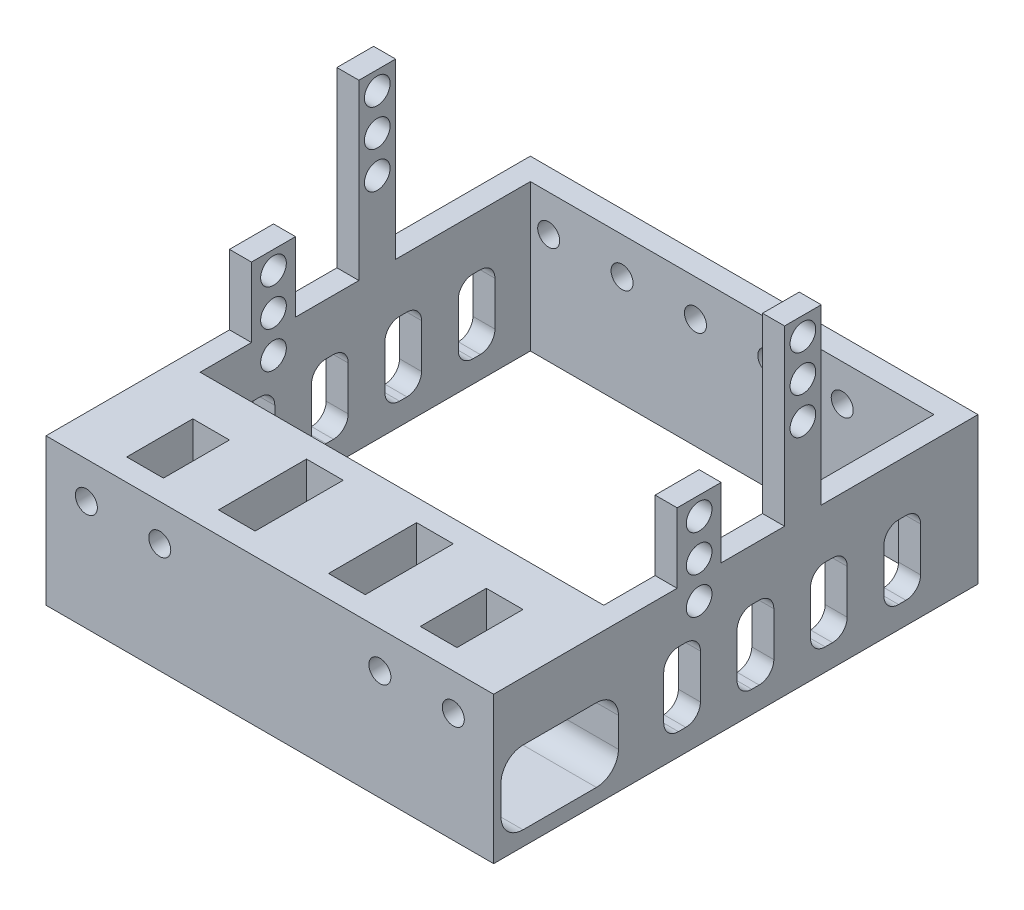
from build123d import *
from build123d.topology import SkipClean

# Parameters (mm, degrees)
SKETCH1_W           = 55
SKETCH1_H           = 10
SKETCH1_R           = 1.5
BOSS_EXTRUDE1_DEPTH = 15
BOSS_EXTRUDE2_START = 3
SKETCH2_R           = 1.5
BOSS_EXTRUDE2_DEPTH = 3
SKETCH3_W           = 55
SKETCH3_H           = 18
BOSS_EXTRUDE3_DEPTH = 10
BOSS_EXTRUDE5_DEPTH = 3
BOSS_EXTRUDE6_DEPTH = 3
CUT_EXTRUDE2_DEPTH  = 84.492514635
SKETCH10_W          = 3
SKETCH10_H          = 20
BOSS_EXTRUDE7_DEPTH = 45
SKETCH11_R          = 1.75
CUT_EXTRUDE3_DEPTH  = 96.131487952
SKETCH12_W          = 5
SKETCH12_H          = 23.64
SKETCH12_R          = 1.75
SKETCH12_W_2        = 6
SKETCH12_H_2        = 9.5
BOSS_EXTRUDE8_DEPTH = 3
BOSS_EXTRUDE9_START = 3
SKETCH13_W          = 61
SKETCH13_H          = 20
SKETCH13_R          = 1.5
BOSS_EXTRUDE9_DEPTH = 3
SKETCH14_W          = 5
SKETCH14_H          = 12
SKETCH14_H_2        = 9
CUT_EXTRUDE4_DEPTH  = 10
CUT_EXTRUDE5_DEPTH  = 97.679884154
SKETCH16_W          = 3
SKETCH16_H          = 45
CUT_EXTRUDE6_DEPTH  = 97.679884154


with BuildPart() as part:
    # Sketch1 → Boss-Extrude1 (new body)
    with BuildSketch(Plane.XY):
        with Locations((-27.5, 5)):
            Rectangle(SKETCH1_W, SKETCH1_H)
        with Locations((-2.5, 5)):
            Circle(SKETCH1_R, mode=Mode.SUBTRACT)
        with Locations((-12.5, 5)):
            Circle(SKETCH1_R, mode=Mode.SUBTRACT)
        with Locations((-42.5, 5)):
            Circle(SKETCH1_R, mode=Mode.SUBTRACT)
        with Locations((-52.5, 5)):
            Circle(SKETCH1_R, mode=Mode.SUBTRACT)
    extrude(amount=BOSS_EXTRUDE1_DEPTH)

    # Sketch2 → Boss-Extrude2 (add)
    with SkipClean():  # the faces are left unmerged after this step: merging them gives an invalid solid
        with BuildSketch(Plane(origin=(0, 0, 0), x_dir=(-1, 0, 0), z_dir=(0, 0, -1)).offset(BOSS_EXTRUDE2_START)):
            with BuildLine():
                Line((0, 0), (55, 0))
                Line((55, 0), (55, 55))
                Line((55, 55), (40, 55))
                Line((40, 55), (40, 24.74951996))
                ThreePointArc((40, 24.74951996), (41, 22.300030217), (40, 19.850540474))
                Line((40, 19.850540474), (40, 10))
                Line((40, 10), (15, 10))
                Line((15, 10), (15, 19.850540474))
                ThreePointArc((15, 19.850540474), (14, 22.300030217), (15, 24.74951996))
                Line((15, 24.74951996), (15, 55))
                Line((15, 55), (0, 55))
                Line((0, 55), (0, 0))
            make_face()
            with Locations((2.5, 5)):
                Circle(SKETCH2_R, mode=Mode.SUBTRACT)
            with Locations((12.5, 5)):
                Circle(SKETCH2_R, mode=Mode.SUBTRACT)
            with Locations((12.5, 50)):
                Circle(SKETCH2_R, mode=Mode.SUBTRACT)
            with Locations((2.5, 50)):
                Circle(SKETCH2_R, mode=Mode.SUBTRACT)
            with Locations((52.5, 5)):
                Circle(SKETCH2_R, mode=Mode.SUBTRACT)
            with Locations((42.5, 5)):
                Circle(SKETCH2_R, mode=Mode.SUBTRACT)
            with Locations((52.5, 50)):
                Circle(SKETCH2_R, mode=Mode.SUBTRACT)
            with Locations((42.5, 50)):
                Circle(SKETCH2_R, mode=Mode.SUBTRACT)
        extrude(amount=-BOSS_EXTRUDE2_DEPTH)

    # Sketch3 → Boss-Extrude3 (add)
    with SkipClean():  # the faces are left unmerged after this step: merging them gives an invalid solid
        with BuildSketch(Plane.XZ):
            with Locations((-27.5, 6)):
                Rectangle(SKETCH3_W, SKETCH3_H)
        extrude(amount=BOSS_EXTRUDE3_DEPTH)

    # Sketch6 → Boss-Extrude5 (add)
    with SkipClean():  # the faces are left unmerged after this step: merging them gives an invalid solid
        with BuildSketch(Plane(origin=(0, 0, 0), x_dir=(0, 0, -1), z_dir=(1, 0, 0))):
            Polygon((-15, 10), (-15, -10), (3, -10), (3, 55), (0, 55), (0, 10), align=None)
        extrude(amount=BOSS_EXTRUDE5_DEPTH)

    # Sketch8 → Boss-Extrude6 (add)
    with SkipClean():  # the faces are left unmerged after this step: merging them gives an invalid solid
        with BuildSketch(Plane.ZY.offset(55)):
            Polygon((15, 10), (0, 10), (0, 55), (-3, 55), (-3, -10), (15, -10), align=None)
        extrude(amount=BOSS_EXTRUDE6_DEPTH)

    # Sketch9 → Cut-Extrude2 (cut, through all)
    with SkipClean():  # the faces are left unmerged after this step: merging them gives an invalid solid
        with BuildSketch(Plane.ZY.offset(58)):
            with BuildLine():
                Line((1, -8), (11, -8))
                ThreePointArc((11, -8), (13.121320344, -7.121320344), (14, -5))
                Line((14, -5), (14, -1))
                ThreePointArc((14, -1), (13.121320344, 1.121320344), (11, 2))
                Line((11, 2), (1, 2))
                ThreePointArc((1, 2), (-1.121320344, 1.121320344), (-2, -1))
                Line((-2, -1), (-2, -5))
                ThreePointArc((-2, -5), (-1.121320344, -7.121320344), (1, -8))
            make_face()
        extrude(amount=-CUT_EXTRUDE2_DEPTH, mode=Mode.SUBTRACT)

    # Sketch10 → Boss-Extrude7 (add)
    with SkipClean():  # the faces are left unmerged after this step: merging them gives an invalid solid
        with BuildSketch(Plane(origin=(0, 0, -3), x_dir=(-1, 0, 0), z_dir=(0, 0, -1))):
            with Locations((56.5, 0)):
                Rectangle(SKETCH10_W, SKETCH10_H)
            with Locations((-1.5, 0)):
                Rectangle(SKETCH10_W, SKETCH10_H)
        extrude(amount=BOSS_EXTRUDE7_DEPTH)

    # Sketch11 → Cut-Extrude3 (cut, through all)
    with SkipClean():  # the faces are left unmerged after this step: merging them gives an invalid solid
        with BuildSketch(Plane.ZY.offset(58)):
            with Locations((-13, 7)):
                Circle(SKETCH11_R)
        extrude(amount=-CUT_EXTRUDE3_DEPTH, mode=Mode.SUBTRACT)

    # Sketch12 → Boss-Extrude8 (add)
    # profile 1 of 2: a face of its own
    with SkipClean():  # the faces are left unmerged after this step: merging them gives an invalid solid
        with BuildSketch(Plane.ZY.offset(58)):
            with Locations((-27.14, 21.82)):
                Rectangle(SKETCH12_W, SKETCH12_H)
            with Locations((-27.14, 31.14)):
                Circle(SKETCH12_R, mode=Mode.SUBTRACT)
            with Locations((-27.14, 26.14)):
                Circle(SKETCH12_R, mode=Mode.SUBTRACT)
            with Locations((-27.14, 21.14)):
                Circle(SKETCH12_R, mode=Mode.SUBTRACT)
        # profile 2 of 2: a face of its own
        with BuildSketch(Plane.ZY.offset(58)):
            with Locations((-13, 14.75)):
                Rectangle(SKETCH12_W_2, SKETCH12_H_2)
            with Locations((-13, 17)):
                Circle(SKETCH12_R, mode=Mode.SUBTRACT)
            with Locations((-13, 12)):
                Circle(SKETCH12_R, mode=Mode.SUBTRACT)
        boss_extrude8 = extrude(amount=-BOSS_EXTRUDE8_DEPTH)

    # Mirror1: Boss-Extrude8 across plane
    with SkipClean():  # the faces are left unmerged after this step: merging them gives an invalid solid
        add(boss_extrude8.mirror(Plane.ZY.offset(27.5)))

    # Sketch13 → Boss-Extrude9 (add)
    with SkipClean():  # the faces are left unmerged after this step: merging them gives an invalid solid
        with BuildSketch(Plane(origin=(0, 0, -48), x_dir=(-1, 0, 0), z_dir=(0, 0, -1)).offset(BOSS_EXTRUDE9_START)):
            with Locations((27.5, 0)):
                Rectangle(SKETCH13_W, SKETCH13_H)
            with Locations((22.5, 5)):
                Circle(SKETCH13_R, mode=Mode.SUBTRACT)
            with Locations((12.5, 5)):
                Circle(SKETCH13_R, mode=Mode.SUBTRACT)
            with Locations((2.5, 5)):
                Circle(SKETCH13_R, mode=Mode.SUBTRACT)
            with Locations((52.5, 5)):
                Circle(SKETCH13_R, mode=Mode.SUBTRACT)
            with Locations((42.5, 5)):
                Circle(SKETCH13_R, mode=Mode.SUBTRACT)
            with Locations((32.5, 5)):
                Circle(SKETCH13_R, mode=Mode.SUBTRACT)
        extrude(amount=-BOSS_EXTRUDE9_DEPTH)

    # Sketch14 → Cut-Extrude4 (cut)
    with SkipClean():  # the faces are left unmerged after this step: merging them gives an invalid solid
        with BuildSketch(Plane(origin=(0, 10, 0), x_dir=(1, 0, 0), z_dir=(0, 1, 0))):
            with Locations((-35, -6)):
                Rectangle(SKETCH14_W, SKETCH14_H)
            with Locations((-47.5, -7.5)):
                Rectangle(SKETCH14_W, SKETCH14_H_2)
            with Locations((-20, -6)):
                Rectangle(SKETCH14_W, SKETCH14_H)
            with Locations((-7.5, -7.5)):
                Rectangle(SKETCH14_W, SKETCH14_H_2)
        extrude(amount=-CUT_EXTRUDE4_DEPTH, mode=Mode.SUBTRACT)

    # Sketch15 → Cut-Extrude5 (cut, through all)
    with SkipClean():  # the faces are left unmerged after this step: merging them gives an invalid solid
        with BuildSketch(Plane.ZY.offset(58)):
            with BuildLine():
                Line((-10.176090021, -7), (-11.176090021, -7))
                ThreePointArc((-11.176090021, -7), (-12.590303583, -6.414213562), (-13.176090021, -5))
                Line((-13.176090021, -5), (-13.176090021, 1))
                ThreePointArc((-13.176090021, 1), (-12.590303583, 2.414213562), (-11.176090021, 3))
                Line((-11.176090021, 3), (-10.176090021, 3))
                ThreePointArc((-10.176090021, 3), (-8.761876459, 2.414213562), (-8.176090021, 1))
                Line((-8.176090021, 1), (-8.176090021, -5))
                ThreePointArc((-8.176090021, -5), (-8.761876459, -6.414213562), (-10.176090021, -7))
            make_face()
            with BuildLine():
                Line((-18.176090021, -5), (-18.176090021, 1))
                ThreePointArc((-18.176090021, 1), (-18.761876459, 2.414213562), (-20.176090021, 3))
                Line((-20.176090021, 3), (-21.176090021, 3))
                ThreePointArc((-21.176090021, 3), (-22.590303583, 2.414213562), (-23.176090021, 1))
                Line((-23.176090021, 1), (-23.176090021, -5))
                ThreePointArc((-23.176090021, -5), (-22.590303583, -6.414213562), (-21.176090021, -7))
                Line((-21.176090021, -7), (-20.176090021, -7))
                ThreePointArc((-20.176090021, -7), (-18.761876459, -6.414213562), (-18.176090021, -5))
            make_face()
            with BuildLine():
                Line((-28.176090021, -5), (-28.176090021, 1))
                ThreePointArc((-28.176090021, 1), (-28.761876459, 2.414213562), (-30.176090021, 3))
                Line((-30.176090021, 3), (-31.176090021, 3))
                ThreePointArc((-31.176090021, 3), (-32.590303583, 2.414213562), (-33.176090021, 1))
                Line((-33.176090021, 1), (-33.176090021, -5))
                ThreePointArc((-33.176090021, -5), (-32.590303583, -6.414213562), (-31.176090021, -7))
                Line((-31.176090021, -7), (-30.176090021, -7))
                ThreePointArc((-30.176090021, -7), (-28.761876459, -6.414213562), (-28.176090021, -5))
            make_face()
            with BuildLine():
                Line((-38.176090021, -5), (-38.176090021, 1))
                ThreePointArc((-38.176090021, 1), (-38.761876459, 2.414213562), (-40.176090021, 3))
                Line((-40.176090021, 3), (-41.176090021, 3))
                ThreePointArc((-41.176090021, 3), (-42.590303583, 2.414213562), (-43.176090021, 1))
                Line((-43.176090021, 1), (-43.176090021, -5))
                ThreePointArc((-43.176090021, -5), (-42.590303583, -6.414213562), (-41.176090021, -7))
                Line((-41.176090021, -7), (-40.176090021, -7))
                ThreePointArc((-40.176090021, -7), (-38.761876459, -6.414213562), (-38.176090021, -5))
            make_face()
        extrude(amount=-CUT_EXTRUDE5_DEPTH, mode=Mode.SUBTRACT)

    # Sketch16 → Cut-Extrude6 (cut, through all)
    with SkipClean():  # the faces are left unmerged after this step: merging them gives an invalid solid
        with BuildSketch(Plane.ZY.offset(58)):
            with Locations((-1.5, 32.5)):
                Rectangle(SKETCH16_W, SKETCH16_H)
        extrude(amount=-CUT_EXTRUDE6_DEPTH, mode=Mode.SUBTRACT)


solid = part.part
